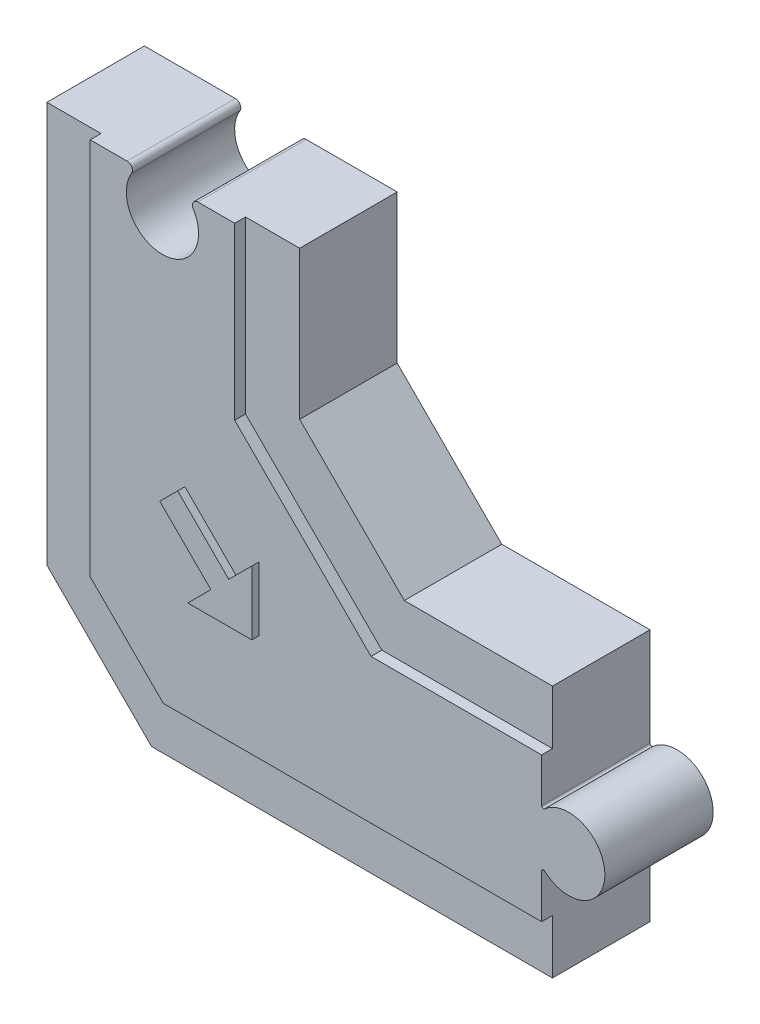
from build123d import *

# Parameters (mm, degrees)
BOSS_EXTRU_1_DEPTH      = 30
BOSS_EXTRU_2_DEPTH      = 30
ENL_V_MAT_EXTRU_1_DEPTH = 152.492574075
ESQUISSE4_R             = 10
ENL_V_MAT_EXTRU_2_DEPTH = 50
ESQUISSE5_R             = 10
BOSS_EXTRU_3_DEPTH      = 30
ENL_V_MAT_EXTRU_3_DEPTH = 3
BOSS_EXTRU_4_DEPTH      = 2
CONG_2_R                = 0.5
CONG_3_R                = 1.5
COQUE1_DEPTH            = 24
COQUE1_START            = 24
COQUE1_2_DEPTH          = 3
COQUE1_START_2          = 27
COQUE1_3_DEPTH          = 2


# Read off the part's stored shape, not the designer's step: Coque1
with BuildPart() as part:
    # Esquisse1 → Boss.-Extru.1 (new body)
    with BuildSketch(Plane.XY):
        Polygon((-35, 105), (35, 105), (35, 35), (105, 35), (105, -35), (-35, -35), align=None)
    extrude(amount=BOSS_EXTRU_1_DEPTH)

    # Esquisse2 → Boss.-Extru.2 (add)
    with BuildSketch(Plane.XY.offset(30)):
        Polygon((35, 63.969429202), (63.969429202, 35), (35, 35), align=None)
    extrude(amount=-BOSS_EXTRU_2_DEPTH)

    # Esquisse3 → Enlèv. mat.-Extru.1 (cut, through all)
    with BuildSketch(Plane.XY.offset(30)):
        Polygon((-35, -35), (-6.009429202, -35), (-35, -6.009429202), align=None)
    extrude(amount=-ENL_V_MAT_EXTRU_1_DEPTH, mode=Mode.SUBTRACT)

    # Esquisse4 → Enlèv. mat.-Extru.2 (cut)
    with BuildSketch(Plane.XY.offset(30)):
        with Locations((0, 97.5)):
            Circle(ESQUISSE4_R)
    extrude(amount=-ENL_V_MAT_EXTRU_2_DEPTH, mode=Mode.SUBTRACT)

    # Esquisse5 → Boss.-Extru.3 (add, through all)
    with BuildSketch(Plane.XY.offset(30)):
        with Locations((112.5, 0)):
            Circle(ESQUISSE5_R)
    extrude(amount=-BOSS_EXTRU_3_DEPTH)

    # Esquisse7 → Enlèv. mat.-Extru.3 (cut)
    with BuildSketch(Plane.XY.offset(30)):
        Polygon((20, 57.756225766), (20, 105), (35, 105), (35, 63.969429202), (63.969429202, 35), (105, 35), (105, 20), (57.756225766, 20), align=None)
        Polygon((0.203774234, -20), (105, -20), (105, -35), (-6.009429202, -35), (-35, -6.009429202), (-35, 105), (-20, 105), (-20, 0.203774234), align=None)
    extrude(amount=-ENL_V_MAT_EXTRU_3_DEPTH, mode=Mode.SUBTRACT)

    # Esquisse8 → Boss.-Extru.4 (add)
    with BuildSketch(Plane.XY.offset(30)):
        Polygon((1.267051582, 29.97688251), (6.21679905, 34.926629979), (20.358934674, 20.784494355), (26.736260006, 27.161819687), (26.736260006, 9.457421554), (9.031861873, 9.457421554), (15.409187205, 15.834746887), align=None)
    extrude(amount=BOSS_EXTRU_4_DEPTH)

    # Congé2
    cong_2_edges = [part.edges().sort_by_distance(p)[0] for p in [
        (105, -6.614378278, 15),
        (105, 6.614378278, 15),
    ]]
    fillet(cong_2_edges, radius=CONG_2_R)

    # Congé3
    cong_3_edges = [part.edges().sort_by_distance(p)[0] for p in [
        (6.614378278, 105, 15),
        (-6.614378278, 105, 15),
    ]]
    fillet(cong_3_edges, radius=CONG_3_R)

    # Coque1 outline → Coque1 (cut)
    with BuildSketch(Plane.XY):
        with BuildLine():
            Line((-32, 102), (-32, -4.766788515))
            Line((-32, -4.766788515), (-4.766788515, -32))
            Line((-4.766788515, -32), (102, -32))
            Line((102, -32), (102, -7.826237921))
            ThreePointArc((102, -7.826237921), (104.071130983, -4.631189669), (107.833333333, -5.217491947))
            ThreePointArc((107.833333333, -5.217491947), (119.5, 0), (107.833333333, 5.217491947))
            ThreePointArc((107.833333333, 5.217491947), (104.071130983, 4.631189669), (102, 7.826237921))
            Line((102, 7.826237921), (102, 32))
            Line((102, 32), (62.726788515, 32))
            Line((62.726788515, 32), (32, 62.726788515))
            Line((32, 62.726788515), (32, 102))
            Line((32, 102), (12.196310918, 102))
            ThreePointArc((12.196310918, 102), (0, 84.5), (-12.196310918, 102))
            Line((-12.196310918, 102), (-32, 102))
        make_face()
    extrude(amount=COQUE1_DEPTH, mode=Mode.SUBTRACT)

    # Coque1 2 outline → Coque1 2 (cut)
    with BuildSketch(Plane.XY.offset(COQUE1_START)):
        with BuildLine():
            Line((-12.196310918, 102), (-17, 102))
            Line((-17, 102), (-17, 1.446414921))
            Line((-17, 1.446414921), (1.446414921, -17))
            Line((1.446414921, -17), (102, -17))
            Line((102, -17), (102, -7.826237921))
            ThreePointArc((102, -7.826237921), (104.071130983, -4.631189669), (107.833333333, -5.217491947))
            ThreePointArc((107.833333333, -5.217491947), (119.5, 0), (107.833333333, 5.217491947))
            ThreePointArc((107.833333333, 5.217491947), (104.071130983, 4.631189669), (102, 7.826237921))
            Line((102, 7.826237921), (102, 17))
            Line((102, 17), (56.513585079, 17))
            Line((56.513585079, 17), (17, 56.513585079))
            Line((17, 56.513585079), (17, 102))
            Line((17, 102), (12.196310918, 102))
            ThreePointArc((12.196310918, 102), (0, 84.5), (-12.196310918, 102))
        make_face()
    extrude(amount=COQUE1_2_DEPTH, mode=Mode.SUBTRACT)

    # Coque1 3 outline → Coque1 3 (cut)
    with BuildSketch(Plane.XY.offset(COQUE1_START_2)):
        Polygon((5.509692269, 29.97688251), (19.651827893, 15.834746887), (16.27450256, 12.457421554), (23.736260006, 12.457421554), (23.736260006, 19.919179), (20.358934674, 16.541853668), (6.21679905, 30.683989291), align=None)
    extrude(amount=COQUE1_3_DEPTH, mode=Mode.SUBTRACT)


solid = part.part
